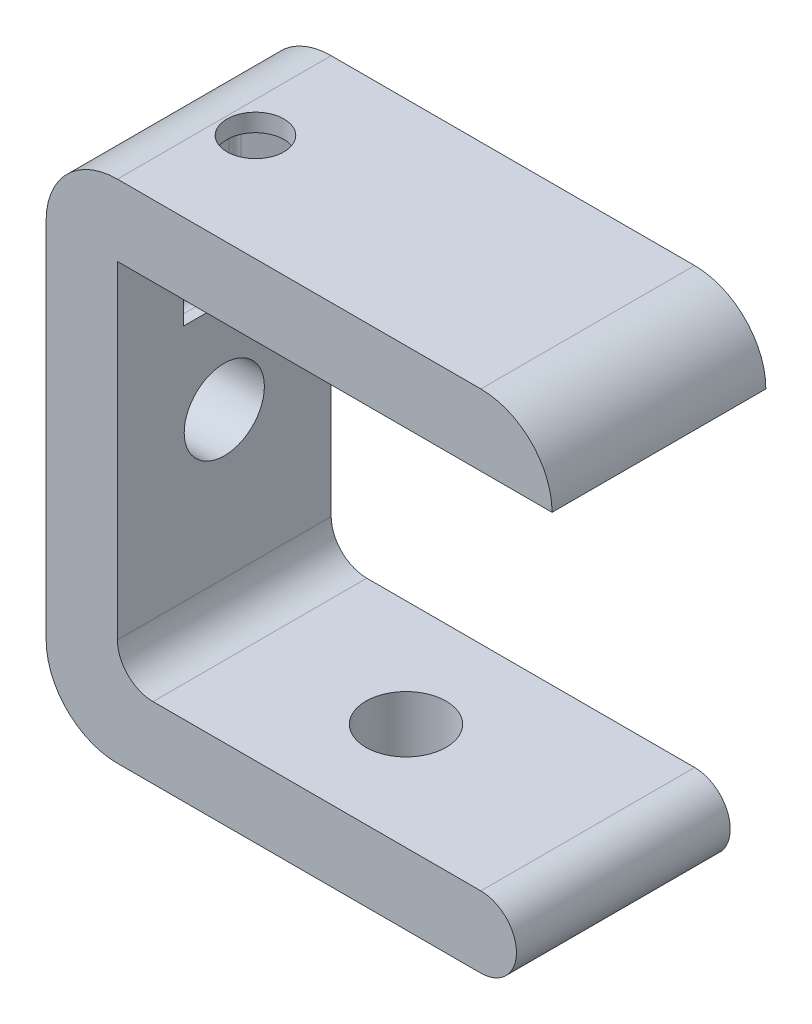
from build123d import *

# Parameters (mm, degrees)
RESSALTO_EXTRUS_O1_DEPTH = 6
ESBO_O3_R                = 1.6
CORTE_EXTRUS_O1_DEPTH    = 4
CORTE_EXTRUS_O2_DEPTH    = 3
CORTE_EXTRUS_O3_DEPTH    = 5
FILETE1_R                = 0.5
FILETE2_R                = 4
FILETE3_R                = 2
ESBO_O6_R                = 2.25
CORTE_EXTRUS_O4_DEPTH    = 10
ESBO_O7_R                = 2.25
CORTE_EXTRUS_O5_DEPTH    = 10


# Some blends are built 0.0001 mm under size
with BuildPart() as part:
    # Esboço1 → Ressalto-extrusão1 (new, symmetric)
    with BuildSketch(Plane.XY):
        Polygon((14.2, 14.2), (-14.2, 14.2), (-14.2, -14.2), (14.2, -14.2), (14.2, -10.2), (10.2, -10.2), (-10.2, -10.2), (-10.2, 10.2), (10.2, 10.2), (14.2, 10.2), align=None)
    extrude(amount=RESSALTO_EXTRUS_O1_DEPTH, both=True)

    # Esboço3 → Corte-extrusão1 (cut)
    with BuildSketch(Plane(origin=(0, 14.2, 0), x_dir=(1, 0, 0), z_dir=(0, 1, 0))):
        with Locations(Location((-8.45, 0, 0), (0, 0, 270))):
            Circle(ESBO_O3_R)
    extrude(amount=-CORTE_EXTRUS_O1_DEPTH, mode=Mode.SUBTRACT)

    # Esboço4 → Corte-extrusão2 (cut)
    with BuildSketch(Plane.XZ.offset(-10.2)):
        Polygon((-8.45, 3.290896534), (-11.3, 1.645448267), (-11.3, -1.645448267), (-8.45, -3.290896534), (-5.6, -1.645448267), (-5.6, 1.645448267), align=None)
    extrude(amount=-CORTE_EXTRUS_O2_DEPTH, mode=Mode.SUBTRACT)

    # Esboço5 → Corte-extrusão3 (cut)
    with BuildSketch(Plane.XZ.offset(-10.2)):
        Polygon((-11.3, -1.645448267), (-10.2, -2.280533563), (-8.45, -3.290896534), (-5.6, -1.645448267), (-5.6, 1.645448267), (-8.45, 3.290896534), (-10.2, 2.280533563), (-11.3, 1.645448267), align=None)
    extrude(amount=CORTE_EXTRUS_O3_DEPTH, mode=Mode.SUBTRACT)

    # Filete1
    filete1_edges = [part.edges().sort_by_distance(p)[0] for p in [
        (-11.3, 9.2, -1.645448267),
        (-11.3, 9.2, 1.645448267),
        (-11.3, 5.2, 0),
    ]]
    fillet(filete1_edges, radius=FILETE1_R)

    # Filete2
    filete2_edges = [part.edges().sort_by_distance(p)[0] for p in [
        (-14.2, -14.2, 0),
        (-14.2, 14.2, 0),
        (14.2, 14.2, 0),
        (14.2, -14.2, 0),
    ]]
    fillet(filete2_edges, radius=FILETE2_R - 0.0001)  # a hair under: the kernel refuses the full size

    # Filete3
    # the kernel refuses this fillet: 2 mm, written as the material it adds along each edge
    with BuildSketch(Plane(origin=(-10.2, -10.2, -6), x_dir=(0, 1, 0), z_dir=(0, 0, 1))) as filete3_piece_1:
        with BuildLine():
            CenterArc((FILETE3_R, -FILETE3_R), FILETE3_R, 90, 90)
            Line((0, -FILETE3_R), (0, 0))
            Line((0, 0), (FILETE3_R, 0))
        make_face()
    extrude(amount=12)
    # the kernel refuses this fillet: 2 mm, written as the material it takes off along each edge
    with BuildSketch(Plane(origin=(14.2, -10.2, -20.141946005), x_dir=(-1, 0, 0), z_dir=(0, 0, 1))) as filete3_2_piece_1:
        with BuildLine():
            CenterArc((3.999896367, 2), FILETE3_R, 90.000104073, 179.999895927)
            Line((3.999892734, 4), (3.999892371, 4.2))
            ThreePointArc((3.999892371, 4.2), (-0.2, 0.0001), (-0.2, 0))
            Line((-0.2, 0), (0, -0.2))
            Line((0, -0.2), (3.999896367, -0.2))
            Line((3.999896367, -0.2), (3.999896367, 0))
        make_face()
    extrude(amount=40.283892009, mode=Mode.SUBTRACT)

    # Esboço6 → Corte-extrusão4 (cut)
    with BuildSketch(Plane.ZY.offset(14.2)):
        Circle(ESBO_O6_R)
    extrude(amount=-CORTE_EXTRUS_O4_DEPTH, mode=Mode.SUBTRACT)

    # Esboço7 → Corte-extrusão5 (cut)
    with BuildSketch(Plane.XZ.offset(14.2)):
        with Locations(Location((0, 0, 0), (0, 0, 270))):
            Circle(ESBO_O7_R)
    extrude(amount=-CORTE_EXTRUS_O5_DEPTH, mode=Mode.SUBTRACT)


solid = part.part
